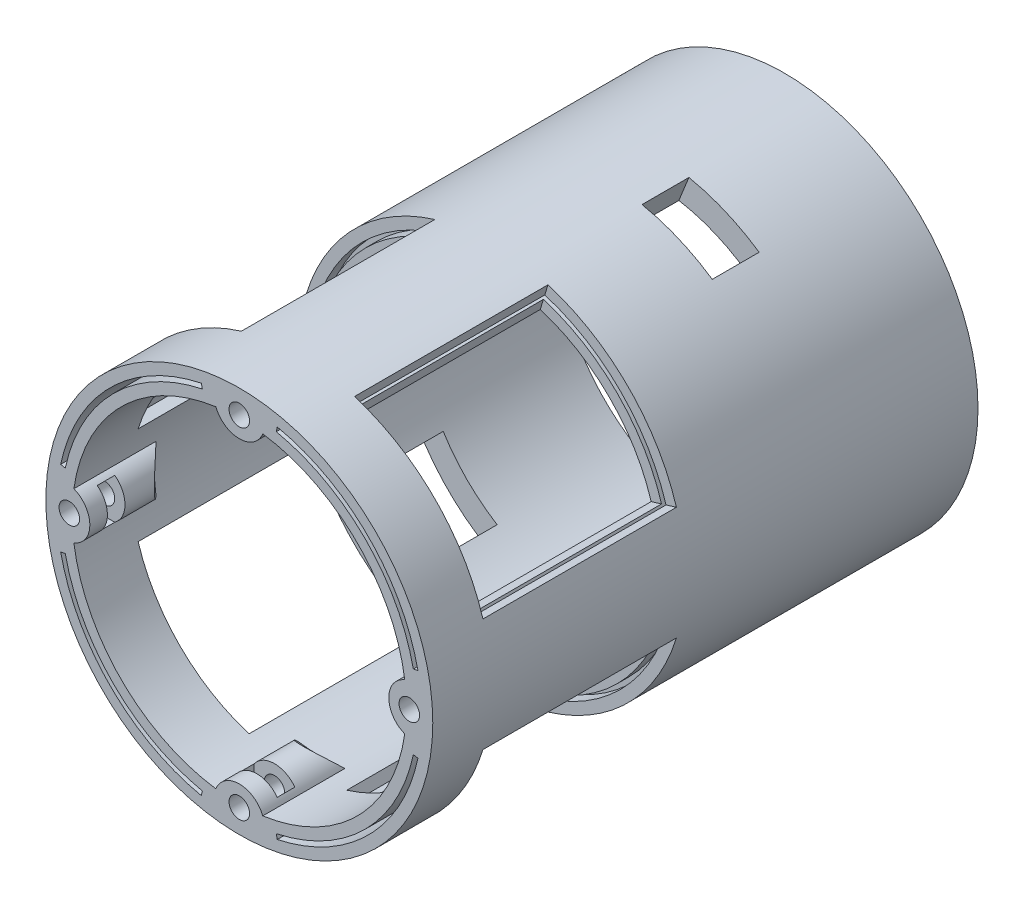
from build123d import *

# Parameters (mm, degrees)
CROQUIS1_R               = 33
CROQUIS1_R_2             = 28.5
BOSS_EXTRUDE1_DEPTH      = 93
CORTAR_EXTRUIR1_DEPTH    = 45
CROQUIS4_W               = 33
CROQUIS4_H               = 4.734026067
CORTAR_REVOLUCI_N2_ANGLE = 56
MATRIZC2_COUNT           = 4
BOSS_EXTRUDE4_DEPTH      = 11
SKETCH9_R                = 1.75
CUT_EXTRUDE3_DEPTH       = 10
SKETCH10_W               = 7
SKETCH10_H               = 15
SKETCH10_W_2             = 8
SKETCH10_H_2             = 13
CORTE_USB_Y_SWITCH_DEPTH = 10
SKETCH11_W               = 8
SKETCH11_H               = 13
CUT_EXTRUDE5_DEPTH       = 10
CHAMFER1_SIZE            = 3
CORTAR_EXTRUIR2_DEPTH    = 3


with BuildPart() as part:
    # Croquis1 → Boss-Extrude1 (new body)
    with BuildSketch(Plane.XY):
        Circle(CROQUIS1_R)
        Circle(CROQUIS1_R_2, mode=Mode.SUBTRACT)
    extrude(amount=BOSS_EXTRUDE1_DEPTH)

    # Croquis2 → Cortar-Extruir1 (cut)
    with BuildSketch(Plane.XY.offset(93)):
        with BuildLine():
            Line((-30.469297763, -6.476449169), (-29.686779682, -6.310119816))
            ThreePointArc((-29.686779682, -6.310119816), (-21.460690809, -21.460690809), (-6.310119816, -29.686779682))
            Line((-6.310119816, -29.686779682), (-6.476449169, -30.469297763))
            ThreePointArc((-6.476449169, -30.469297763), (-22.026376234, -22.026376234), (-30.469297763, -6.476449169))
        make_face()
        with BuildLine():
            Line((-30.469297763, 6.476449169), (-29.686779682, 6.310119816))
            ThreePointArc((-29.686779682, 6.310119816), (-21.460690809, 21.460690809), (-6.310119816, 29.686779682))
            Line((-6.310119816, 29.686779682), (-6.476449169, 30.469297763))
            ThreePointArc((-6.476449169, 30.469297763), (-22.026376234, 22.026376234), (-30.469297763, 6.476449169))
        make_face()
        with BuildLine():
            Line((6.476449169, 30.469297763), (6.310119816, 29.686779682))
            ThreePointArc((6.310119816, 29.686779682), (21.460690809, 21.460690809), (29.686779682, 6.310119816))
            Line((29.686779682, 6.310119816), (30.469297763, 6.476449169))
            ThreePointArc((30.469297763, 6.476449169), (22.026376234, 22.026376234), (6.476449169, 30.469297763))
        make_face()
        with BuildLine():
            Line((30.469297763, -6.476449169), (29.686779682, -6.310119816))
            ThreePointArc((29.686779682, -6.310119816), (21.460690809, -21.460690809), (6.310119816, -29.686779682))
            Line((6.310119816, -29.686779682), (6.476449169, -30.469297763))
            ThreePointArc((6.476449169, -30.469297763), (22.026376234, -22.026376234), (30.469297763, -6.476449169))
        make_face()
    extrude(amount=-CORTAR_EXTRUIR1_DEPTH, mode=Mode.SUBTRACT)

    # Croquis4 → Cortar-Revolución2 (revolve, cut)
    with BuildSketch(Plane(origin=(0, 0, 0), x_dir=(0, 0, -1), z_dir=(0.9563047559630322, -0.29237170472274765, 0))):
        with Locations((-66.5, 30.632986966)):
            Rectangle(CROQUIS4_W, CROQUIS4_H)
    cortar_revoluci_n2 = revolve(axis=Axis((0, 0, 93), (0, 0, -1)), revolution_arc=CORTAR_REVOLUCI_N2_ANGLE, mode=Mode.SUBTRACT)

    # MatrizC2: Cortar-Revolución2 ×4 about axis
    matrizc2_axis = Axis((0, 0, 93), (0, 0, -1))
    for i in range(1, MATRIZC2_COUNT):
        add(cortar_revoluci_n2.rotate(matrizc2_axis, i * 360 / MATRIZC2_COUNT), mode=Mode.SUBTRACT)

    # Sketch8 → Boss-Extrude4 (add)
    with BuildSketch(Plane(origin=(0, 0, 0), x_dir=(-1, 0, 0), z_dir=(0, 0, -1))):
        with BuildLine():
            ThreePointArc((-4, -28.217902119), (0, -28.5), (4, -28.217902119))
            ThreePointArc((4, -28.217902119), (0, -25.495875503), (-4, -28.217902119))
        make_face()
        with BuildLine():
            ThreePointArc((-28.217902119, 4), (-28.5, 0), (-28.217902119, -4))
            ThreePointArc((-28.217902119, -4), (-25.495875503, 0), (-28.217902119, 4))
        make_face()
        with BuildLine():
            ThreePointArc((4, 28.217902119), (0, 28.5), (-4, 28.217902119))
            ThreePointArc((-4, 28.217902119), (0, 25.495875503), (4, 28.217902119))
        make_face()
        with BuildLine():
            ThreePointArc((28.217902119, -4), (28.5, 0), (28.217902119, 4))
            ThreePointArc((28.217902119, 4), (25.495875503, 0), (28.217902119, -4))
        make_face()
    boss_extrude4 = extrude(amount=-BOSS_EXTRUDE4_DEPTH)

    # Sketch9 → Cut-Extrude3 (cut)
    with BuildSketch(Plane(origin=(0, 0, 0), x_dir=(-1, 0, 0), z_dir=(0, 0, -1))):
        with Locations((0, -29)):
            Circle(SKETCH9_R)
        with Locations((-29, 0)):
            Circle(SKETCH9_R)
        with Locations((0, 29)):
            Circle(SKETCH9_R)
        with Locations((29, 0)):
            Circle(SKETCH9_R)
    cut_extrude3 = extrude(amount=-CUT_EXTRUDE3_DEPTH, mode=Mode.SUBTRACT)

    # Mirror1: Boss-Extrude4, Cut-Extrude3 across plane
    add(boss_extrude4.mirror(Plane.XY.offset(46.5)))
    add(cut_extrude3.mirror(Plane.XY.offset(46.5)), mode=Mode.SUBTRACT)

    # Sketch10 → Corte USB y Switch (cut)
    with BuildSketch(Plane(origin=(-23.334523779, -23.334523779, 0), x_dir=(0, 0, -1), z_dir=(-0.7071067811865488, -0.7071067811865464, 0))):
        with Locations((-7, 0)):
            Rectangle(SKETCH10_W, SKETCH10_H)
        with Locations((-38, 0)):
            Rectangle(SKETCH10_W_2, SKETCH10_H_2)
    extrude(amount=-CORTE_USB_Y_SWITCH_DEPTH, mode=Mode.SUBTRACT)

    # Sketch11 → Cut-Extrude5 (cut)
    with BuildSketch(Plane(origin=(12.362017583, 30.597067201, 0), x_dir=(0, 0, -1), z_dir=(0.37460659341590646, 0.9271838545667896, 0))):
        with Locations((-26.9, -0.5)):
            Rectangle(SKETCH11_W, SKETCH11_H)
    extrude(amount=-CUT_EXTRUDE5_DEPTH, mode=Mode.SUBTRACT)

    # Chamfer1
    chamfer1_edges = [part.edges().sort_by_distance(p)[0] for p in [
        (0, 28.5, 82),
        (-28.5, 0, 82),
        (28.429388055, -2.004967532, 82),
        (0, -28.5, 82),
    ]]
    chamfer(chamfer1_edges, length=CHAMFER1_SIZE)

    # Croquis6 → Cortar-Extruir2 (cut)
    with BuildSketch(Plane.XY.offset(90)):
        with BuildLine():
            Line((-3.464101615, -27.248327662), (-3.464101615, -29))
            Line((-3.464101615, -29), (-1.732050808, -32))
            Line((-1.732050808, -32), (1.732050808, -32))
            Line((1.732050808, -32), (3.464101615, -29))
            Line((3.464101615, -29), (3.464101615, -27.248327662))
            ThreePointArc((3.464101615, -27.248327662), (0, -25.495875503), (-3.464101615, -27.248327662))
        make_face()
        with BuildLine():
            Line((-32, -1.732050808), (-29, -3.464101615))
            Line((-29, -3.464101615), (-27.248327662, -3.464101615))
            ThreePointArc((-27.248327662, -3.464101615), (-25.495875503, 0), (-27.248327662, 3.464101615))
            Line((-27.248327662, 3.464101615), (-29, 3.464101615))
            Line((-29, 3.464101615), (-32, 1.732050808))
            Line((-32, 1.732050808), (-32, -1.732050808))
        make_face()
        with BuildLine():
            Line((-1.732050808, 32), (-3.464101615, 29))
            Line((-3.464101615, 29), (-3.464101615, 27.248327662))
            ThreePointArc((-3.464101615, 27.248327662), (0, 25.495875503), (3.464101615, 27.248327662))
            Line((3.464101615, 27.248327662), (3.464101615, 29))
            Line((3.464101615, 29), (1.732050808, 32))
            Line((1.732050808, 32), (-1.732050808, 32))
        make_face()
        with BuildLine():
            Line((32, 1.732050808), (29, 3.464101615))
            Line((29, 3.464101615), (27.248327662, 3.464101615))
            ThreePointArc((27.248327662, 3.464101615), (25.495875503, 0), (27.248327662, -3.464101615))
            Line((27.248327662, -3.464101615), (29, -3.464101615))
            Line((29, -3.464101615), (32, -1.732050808))
            Line((32, -1.732050808), (32, 1.732050808))
        make_face()
    cortar_extruir2 = extrude(amount=-CORTAR_EXTRUIR2_DEPTH, mode=Mode.SUBTRACT)

    # Simetría1: Cortar-Extruir2 across plane
    add(cortar_extruir2.mirror(Plane.XY.offset(46.5)), mode=Mode.SUBTRACT)


solid = part.part
